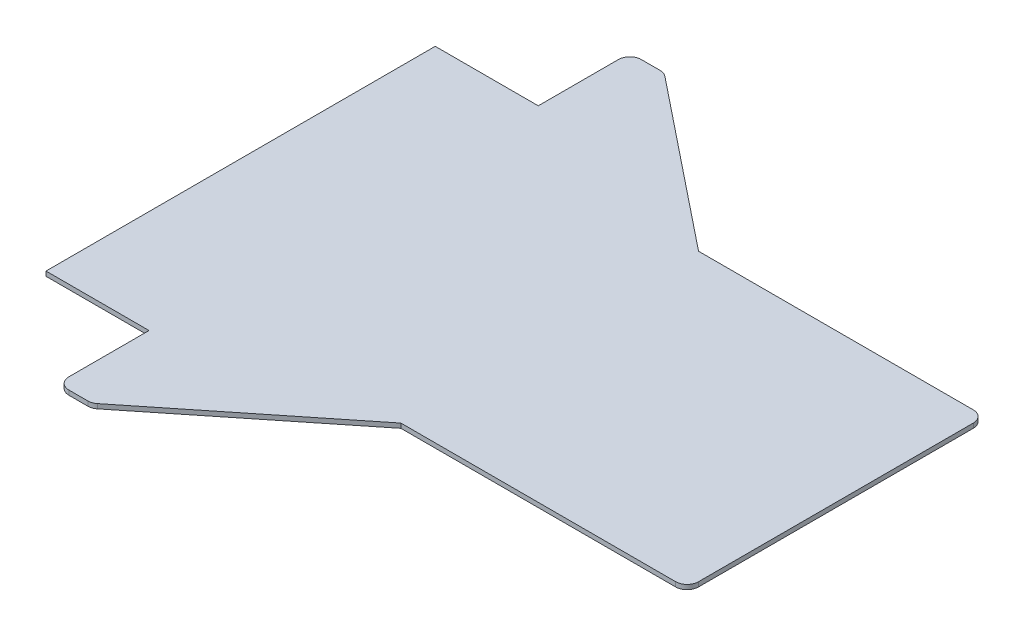
from build123d import *

# Parameters (mm, degrees)
SKETCH_1_W          = 260
SKETCH_1_H          = 250
EXTRUDE_1_DEPTH     = 2
SKETCH_2_W          = 125
SKETCH_2_H          = 60
SKETCH_2_W_2        = 45
SKETCH_2_H_2        = 40
CUT_EXTRUDE_1_DEPTH = 10
CUT_EXTRUDE_2_DEPTH = 10
FILLET_1_R          = 5


with BuildPart() as part:
    # 스케치1 → 보스-돌출1 (new body)
    with BuildSketch(Plane(origin=(0, 0, 0), x_dir=(1, 0, 0), z_dir=(0, 1, 0))):
        Rectangle(SKETCH_1_W, SKETCH_1_H)
    extrude(amount=EXTRUDE_1_DEPTH)

    # 스케치2 → 컷-돌출1 (cut)
    with BuildSketch(Plane(origin=(0, 2, 0), x_dir=(1, 0, 0), z_dir=(0, 1, 0))):
        with Locations((67.5, 95)):
            Rectangle(SKETCH_2_W, SKETCH_2_H)
        with Locations((67.5, -95)):
            Rectangle(SKETCH_2_W, SKETCH_2_H)
        with Locations((-107.5, 105)):
            Rectangle(SKETCH_2_W_2, SKETCH_2_H_2)
        with Locations((-107.5, -105)):
            Rectangle(SKETCH_2_W_2, SKETCH_2_H_2)
    extrude(amount=-CUT_EXTRUDE_1_DEPTH, mode=Mode.SUBTRACT)

    # 스케치3 → 컷-돌출2 (cut)
    with BuildSketch(Plane(origin=(0, 2, 0), x_dir=(1, 0, 0), z_dir=(0, 1, 0))):
        Polygon((-70, 125), (5, 65), (5, 125), align=None)
        Polygon((-70, -125), (5, -65), (5, -125), align=None)
    extrude(amount=-CUT_EXTRUDE_2_DEPTH, mode=Mode.SUBTRACT)

    # 필렛1
    fillet_1_edges = [part.edges().sort_by_distance(p)[0] for p in [
        (-70, 1, 125),
        (-70, 1, -125),
        (-85, 1, -125),
        (-85, 1, 125),
        (130, 1, 65),
        (130, 1, -65),
    ]]
    fillet(fillet_1_edges, radius=FILLET_1_R)


solid = part.part
